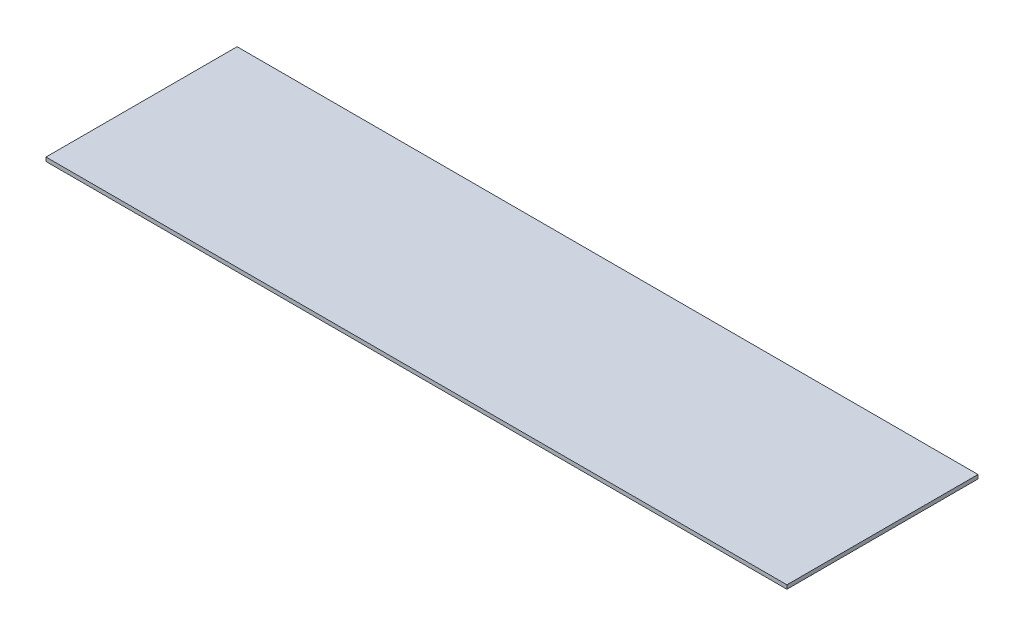
from build123d import *

# Parameters (mm, degrees)
SKETCH1_W           = 98
SKETCH1_H           = 2
BOSS_EXTRUDE1_DEPTH = 380


with BuildPart() as part:
    # Sketch1 → Boss-Extrude1 (new body)
    with BuildSketch(Plane(origin=(0, 0, 0), x_dir=(0, 0, -1), z_dir=(1, 0, 0))):
        with Locations((49, 1)):
            Rectangle(SKETCH1_W, SKETCH1_H)
    extrude(amount=BOSS_EXTRUDE1_DEPTH)


solid = part.part
